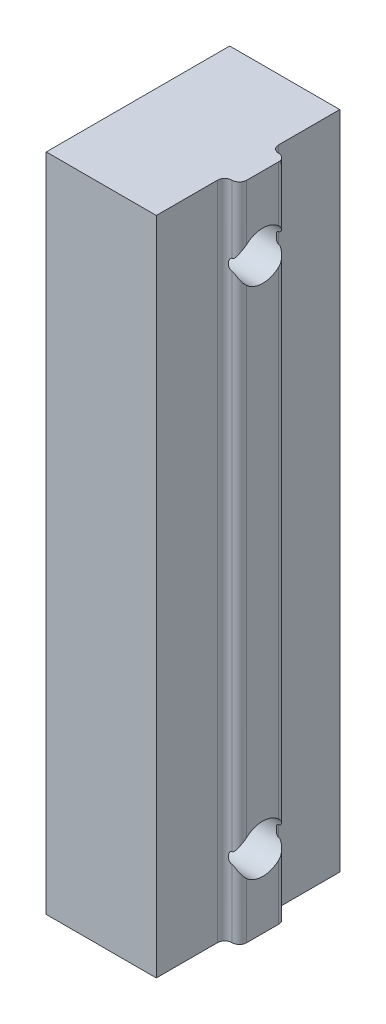
from build123d import *

# Parameters (mm, degrees)
BOSS_EXTRUDE1_DEPTH = 25
SKETCH3_R           = 4.8
CUT_EXTRUDE1_DEPTH  = 7.5
SKETCH6_W           = 2
SKETCH6_H           = 6.35
BOSS_EXTRUDE2_DEPTH = 90
FILLET2_R           = 1
SKETCH7_R           = 3.265
CUT_EXTRUDE2_DEPTH  = 55.212544674


with BuildPart() as part:
    # Sketch2 → Boss-Extrude1 (new body)
    with BuildSketch(Plane.XY):
        Polygon((18, 45), (18, 25), (18, -25), (18, -45), (33, -45), (33, 45), align=None)
    extrude(amount=BOSS_EXTRUDE1_DEPTH)

    # Sketch3 → Cut-Extrude1 (cut)
    with BuildSketch(Plane(origin=(18, 0, 0), x_dir=(0, 0, -1), z_dir=(1, 0, 0))):
        with Locations(Location((-12.5, 0, 0), (0, 0, 90))):
            Circle(SKETCH3_R)
    extrude(amount=CUT_EXTRUDE1_DEPTH, mode=Mode.SUBTRACT)

    # Sketch6 → Boss-Extrude2 (add, through all)
    with BuildSketch(Plane(origin=(0, 45, 0), x_dir=(1, 0, 0), z_dir=(0, 1, 0))):
        with Locations((34, -12.5)):
            Rectangle(SKETCH6_W, SKETCH6_H)
    extrude(amount=-BOSS_EXTRUDE2_DEPTH)

    # Fillet2
    fillet2_edges = [part.edges().sort_by_distance(p)[0] for p in [
        (33, 0, 9.325),
        (33, 0, 15.675),
    ]]
    fillet(fillet2_edges, radius=FILLET2_R)
    fillet2_2_edges = [part.edges().sort_by_distance(p)[0] for p in [
        (35, 0, 9.325),
        (35, 0, 15.675),
    ]]
    fillet(fillet2_2_edges, radius=FILLET2_R - 0.0001)  # a hair under: the kernel refuses the full size

    # Sketch7 → Cut-Extrude2 (cut, through all)
    with BuildSketch(Plane.ZY.offset(-18)):
        with Locations(Location((12.5, 35, 0), (0, 0, 270))):
            Circle(SKETCH7_R)
        with Locations(Location((12.5, -35, 0), (0, 0, 270))):
            Circle(SKETCH7_R)
    extrude(amount=-CUT_EXTRUDE2_DEPTH, mode=Mode.SUBTRACT)


solid = part.part
